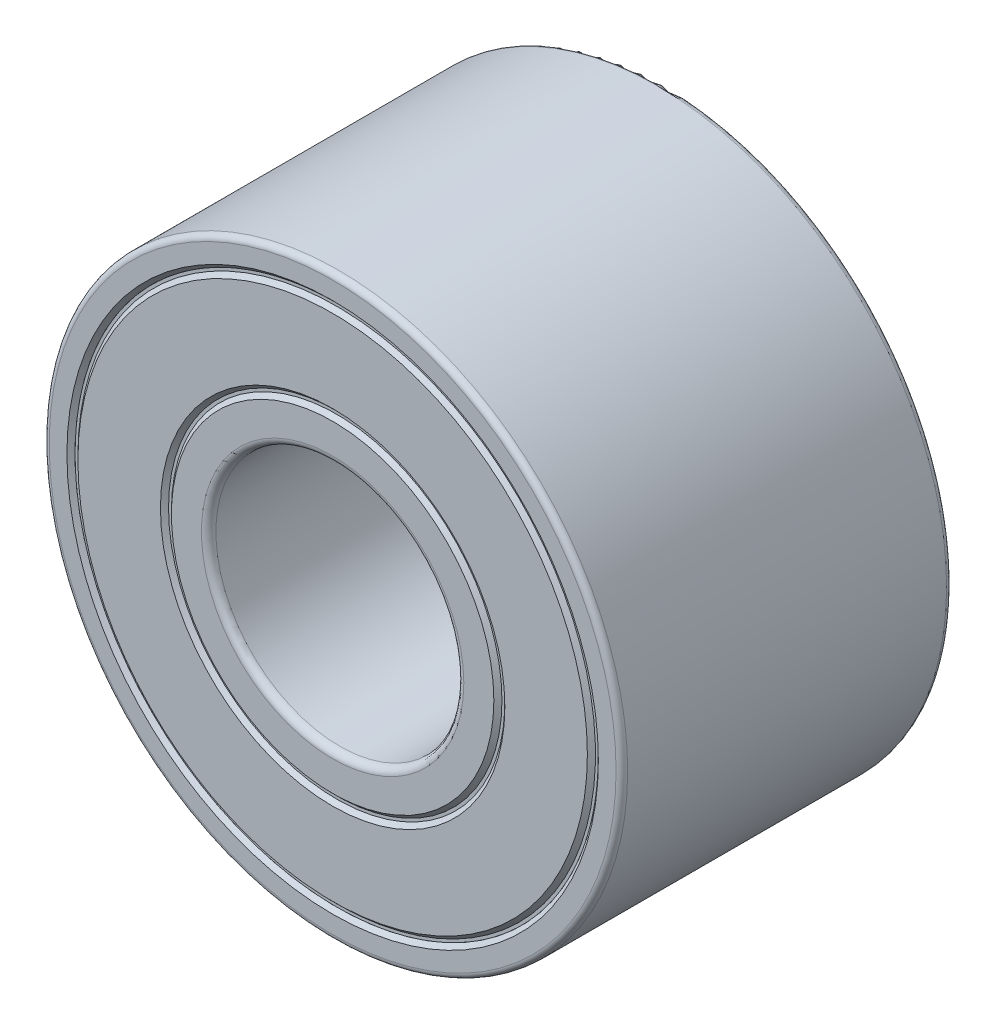
from build123d import *

# Parameters (mm, degrees)
SKETCH3_W         = 4
SKETCH3_H         = 0.333333333
SKETCH3_H_2       = 0.5
SKETCH4_R         = 0.7
CIRPATTERN1_COUNT = 7
FILLET1_R         = 0.07
FILLET2_R         = 0.0875
CHAMFER1_SIZE     = 0.049
CHAMFER2_SIZE     = 0.049


# Read off the part's stored shape, not the designer's step: Thicken1
with BuildPart() as part:
    # Sketch3 → Revolve1 (revolve)
    with BuildSketch(Plane(origin=(0, 0, 0), x_dir=(0, 0, -1), z_dir=(1, 0, 0)), mode=Mode.PRIVATE) as revolve1_sk:
        with Locations((0, -3.333333334)):
            Rectangle(SKETCH3_W, SKETCH3_H)
        with Locations((0, -1.75)):
            Rectangle(SKETCH3_W, SKETCH3_H_2)
    revolve(revolve1_sk.sketch.rotate(Axis((0, 0, 2), (0, 0, -1)), 270), axis=Axis((0, 0, 2), (0, 0, -1)))

    # Sketch4 → Cut-Revolve1 (revolve, cut)
    with BuildSketch(Plane(origin=(0, 0, 0), x_dir=(0, 0, -1), z_dir=(1, 0, 0)), mode=Mode.PRIVATE) as cut_revolve1_sk:
        with Locations((0, -2.583333333)):
            Circle(SKETCH4_R)
    revolve(cut_revolve1_sk.sketch.rotate(Axis((0, 0, 2), (0, 0, -1)), 270), axis=Axis((0, 0, 2), (0, 0, -1)), mode=Mode.SUBTRACT)

    # Fillet1
    fillet1_edges = [part.edges().sort_by_distance(p)[0] for p in [
        (-3.5, 0, -2),
        (-3.5, 0, 2),
    ]]
    fillet(fillet1_edges, radius=FILLET1_R)

    # Fillet2
    fillet2_edges = [part.edges().sort_by_distance(p)[0] for p in [
        (-1.5, 0, -2),
        (-1.5, 0, 2),
    ]]
    fillet(fillet2_edges, radius=FILLET2_R)

    # Chamfer1
    chamfer1_edges = [part.edges().sort_by_distance(p)[0] for p in [
        (-3.166666667, 0, 2),
        (-3.166666667, 0, -2),
    ]]
    chamfer(chamfer1_edges, length=CHAMFER1_SIZE)

    # Chamfer2
    chamfer2_edges = [part.edges().sort_by_distance(p)[0] for p in [
        (-2, 0, 2),
        (-2, 0, -2),
    ]]
    chamfer(chamfer2_edges, length=CHAMFER2_SIZE)


with BuildPart() as body_2:
    # Sketch5 → Revolve2 (revolve)
    with BuildSketch(Plane(origin=(0, 0, 0), x_dir=(0, 0, -1), z_dir=(1, 0, 0))):
        with BuildLine():
            Line((0, -1.883333333), (0, -3.283333333))
            ThreePointArc((0, -3.283333333), (0.7, -2.583333333), (0, -1.883333333))
        make_face()
    revolve(axis=Axis((0, -1.883333333, 0), (0, -1, 0)))


with BuildPart() as cirpattern1_1:
    # CirPattern1: pattern copy
    add(body_2.part.rotate(Axis((0, 0, 0), (0, 0, 1)), 1 * 360 / CIRPATTERN1_COUNT))


with BuildPart() as cirpattern1_2:
    # CirPattern1: pattern copy
    add(body_2.part.rotate(Axis((0, 0, 0), (0, 0, 1)), 2 * 360 / CIRPATTERN1_COUNT))


with BuildPart() as cirpattern1_3:
    # CirPattern1: pattern copy
    add(body_2.part.rotate(Axis((0, 0, 0), (0, 0, 1)), 3 * 360 / CIRPATTERN1_COUNT))


with BuildPart() as cirpattern1_4:
    # CirPattern1: pattern copy
    add(body_2.part.rotate(Axis((0, 0, 0), (0, 0, 1)), 4 * 360 / CIRPATTERN1_COUNT))


with BuildPart() as cirpattern1_5:
    # CirPattern1: pattern copy
    add(body_2.part.rotate(Axis((0, 0, 0), (0, 0, 1)), 5 * 360 / CIRPATTERN1_COUNT))


with BuildPart() as cirpattern1_6:
    # CirPattern1: pattern copy
    add(body_2.part.rotate(Axis((0, 0, 0), (0, 0, 1)), 6 * 360 / CIRPATTERN1_COUNT))


with BuildPart() as body_9:
    # Thicken1 outline → Thicken1 (revolve)
    with BuildSketch(Plane.XZ):
        Polygon((2, 1.951), (2, 1.824), (2.087605122, 1.824), (2.136605122, 1.873), (3.030061544, 1.873), (3.079061544, 1.824), (3.166666667, 1.824), (3.166666667, 1.951), (3.131666667, 1.951), (3.082666667, 2), (2.084, 2), (2.035, 1.951), align=None)
    revolve(axis=Axis((0, 0, 0), (0, 0, 1)))


with BuildPart() as body_10:
    # Mirror1: mirrored copy
    add(body_9.part.mirror(Plane.XY))


solid = Compound([part.part, body_2.part, cirpattern1_1.part, cirpattern1_2.part, cirpattern1_3.part, cirpattern1_4.part, cirpattern1_5.part, cirpattern1_6.part, body_9.part, body_10.part])
